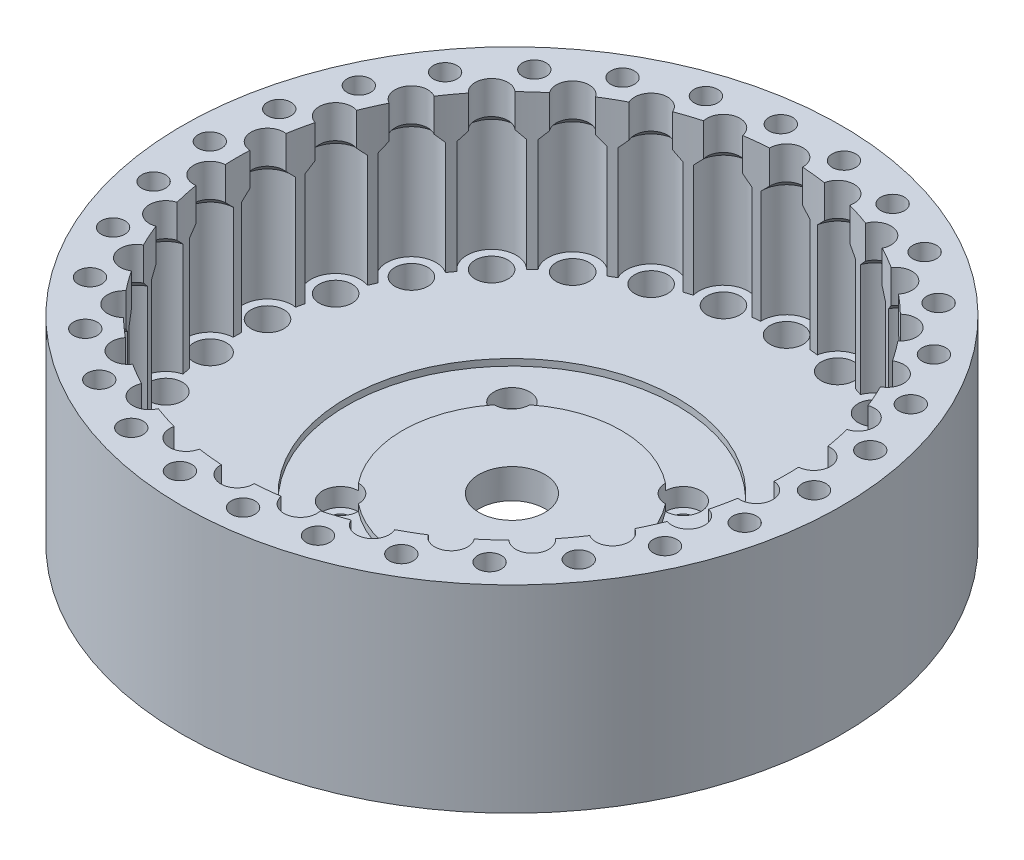
from build123d import *
from build123d.topology import SkipClean

# Parameters (mm, degrees)
SKETCH1_R                                           = 60
BOSS_EXTRUDE1_DEPTH                                 = 8
SKETCH2_R                                           = 3
CUT_EXTRUDE2_DEPTH                                  = 6
SKETCH3_R                                           = 60
BOSS_EXTRUDE2_DEPTH                                 = 28
BOSS_EXTRUDE3_START                                 = -6
BOSS_EXTRUDE3_DEPTH                                 = 6
CHAMFER1_SIZE                                       = 1.5
SKETCH5_R                                           = 6
CUT_EXTRUDE3_DEPTH                                  = 90.353231615
CBORE_FOR_M3_HEX_SOCKET_HEAD_CAP_SCREW1_D           = 3.6
CBORE_FOR_M3_HEX_SOCKET_HEAD_CAP_SCREW1_CBORE_D     = 6.5
CBORE_FOR_M3_HEX_SOCKET_HEAD_CAP_SCREW1_CBORE_DEPTH = 4.5
SKETCH10_R                                          = 11.25
CUT_EXTRUDE5_DEPTH                                  = 2.6
SKETCH11_R                                          = 30.1
SKETCH11_R_2                                        = 19.9
CUT_EXTRUDE6_DEPTH                                  = 1.2
F_4_3_4_3_DIAMETER_HOLE1_D                          = 4.3


with BuildPart() as part:
    # Sketch1 → Boss-Extrude1 (new body)
    with BuildSketch(Plane(origin=(0, 0, 0), x_dir=(1, 0, 0), z_dir=(0, 1, 0))):
        with Locations(Location((0, 0, 0), (0, 0, 270))):
            Circle(SKETCH1_R)
    extrude(amount=BOSS_EXTRUDE1_DEPTH)

    # Sketch2 → Cut-Extrude2 (cut)
    with BuildSketch(Plane(origin=(0, 8, 0), x_dir=(1, 0, 0), z_dir=(0, 1, 0))):
        with Locations(Location((0, 50, 0), (0, 0, 270))):
            Circle(SKETCH2_R)
        with Locations(Location((10.395584541, 48.907380037, 0), (0, 0, 270))):
            Circle(SKETCH2_R)
        with Locations(Location((20.336832154, 45.677272882, 0), (0, 0, 270))):
            Circle(SKETCH2_R)
        with Locations(Location((29.389262615, 40.450849719, 0), (0, 0, 270))):
            Circle(SKETCH2_R)
        with Locations(Location((37.157241274, 33.456530318, 0), (0, 0, 270))):
            Circle(SKETCH2_R)
        with Locations(Location((43.301270189, 25, 0), (0, 0, 270))):
            Circle(SKETCH2_R)
        with Locations(Location((47.552825815, 15.450849719, 0), (0, 0, 270))):
            Circle(SKETCH2_R)
        with Locations(Location((49.726094768, 5.226423163, 0), (0, 0, 270))):
            Circle(SKETCH2_R)
        with Locations(Location((49.726094768, -5.226423163, 0), (0, 0, 270))):
            Circle(SKETCH2_R)
        with Locations(Location((47.552825815, -15.450849719, 0), (0, 0, 270))):
            Circle(SKETCH2_R)
        with Locations(Location((43.301270189, -25, 0), (0, 0, 270))):
            Circle(SKETCH2_R)
        with Locations(Location((37.157241274, -33.456530318, 0), (0, 0, 270))):
            Circle(SKETCH2_R)
        with Locations(Location((29.389262615, -40.450849719, 0), (0, 0, 270))):
            Circle(SKETCH2_R)
        with Locations(Location((20.336832154, -45.677272882, 0), (0, 0, 270))):
            Circle(SKETCH2_R)
        with Locations(Location((10.395584541, -48.907380037, 0), (0, 0, 270))):
            Circle(SKETCH2_R)
        with Locations(Location((0, -50, 0), (0, 0, 270))):
            Circle(SKETCH2_R)
        with Locations(Location((-10.395584541, -48.907380037, 0), (0, 0, 270))):
            Circle(SKETCH2_R)
        with Locations(Location((-20.336832154, -45.677272882, 0), (0, 0, 270))):
            Circle(SKETCH2_R)
        with Locations(Location((-29.389262615, -40.450849719, 0), (0, 0, 270))):
            Circle(SKETCH2_R)
        with Locations(Location((-37.157241274, -33.456530318, 0), (0, 0, 270))):
            Circle(SKETCH2_R)
        with Locations(Location((-43.301270189, -25, 0), (0, 0, 270))):
            Circle(SKETCH2_R)
        with Locations(Location((-47.552825815, -15.450849719, 0), (0, 0, 270))):
            Circle(SKETCH2_R)
        with Locations(Location((-49.726094768, -5.226423163, 0), (0, 0, 270))):
            Circle(SKETCH2_R)
        with Locations(Location((-49.726094768, 5.226423163, 0), (0, 0, 270))):
            Circle(SKETCH2_R)
        with Locations(Location((-47.552825815, 15.450849719, 0), (0, 0, 270))):
            Circle(SKETCH2_R)
        with Locations(Location((-43.301270189, 25, 0), (0, 0, 270))):
            Circle(SKETCH2_R)
        with Locations(Location((-37.157241274, 33.456530318, 0), (0, 0, 270))):
            Circle(SKETCH2_R)
        with Locations(Location((-29.389262615, 40.450849719, 0), (0, 0, 270))):
            Circle(SKETCH2_R)
        with Locations(Location((-20.336832154, 45.677272882, 0), (0, 0, 270))):
            Circle(SKETCH2_R)
        with Locations(Location((-10.395584541, 48.907380037, 0), (0, 0, 270))):
            Circle(SKETCH2_R)
    extrude(amount=-CUT_EXTRUDE2_DEPTH, mode=Mode.SUBTRACT)

    # Sketch3 → Boss-Extrude2 (add)
    with BuildSketch(Plane(origin=(0, 8, 0), x_dir=(1, 0, 0), z_dir=(0, 1, 0))):
        with Locations(Location((0, 0, 0), (0, 0, 270))):
            Circle(SKETCH3_R)
        with BuildLine():
            ThreePointArc((-5.956277164, 49.643959979), (-5.226423163, 49.726094768), (-4.495441441, 49.7975))
            ThreePointArc((-4.495441441, 49.7975), (-0.101275652, 54.498860216), (4.5, 50))
            ThreePointArc((4.5, 50), (4.498860216, 49.898724348), (4.495441441, 49.7975))
            ThreePointArc((4.495441441, 49.7975), (5.226423163, 49.726094768), (5.956277164, 49.643959979))
            ThreePointArc((5.956277164, 49.643959979), (10.765122633, 53.392181214), (14.895584541, 48.907380037))
            ThreePointArc((14.895584541, 48.907380037), (14.859213342, 48.336400239), (14.750687683, 47.774650317))
            ThreePointArc((14.750687683, 47.774650317), (15.450849719, 47.552825815), (16.147677875, 47.320740688))
            ThreePointArc((16.147677875, 47.320740688), (21.173135252, 50.0988786), (24.836832154, 45.677272882))
            ThreePointArc((24.836832154, 45.677272882), (24.716325088, 44.642844712), (24.361258092, 43.663819166))
            ThreePointArc((24.361258092, 43.663819166), (25, 43.301270189), (25.633347578, 42.929377959))
            ThreePointArc((25.633347578, 42.929377959), (30.683168008, 44.76081594), (33.889262615, 40.450849719))
            ThreePointArc((33.889262615, 40.450849719), (33.636637041, 38.964306588), (32.907124624, 37.644669596))
            ThreePointArc((32.907124624, 37.644669596), (33.456530318, 37.157241274), (33.998716989, 36.661795415))
            ThreePointArc((33.998716989, 36.661795415), (38.894572664, 37.607636151), (41.657241274, 33.456530318))
            ThreePointArc((41.657241274, 33.456530318), (41.22596207, 31.534159105), (40.014791904, 29.980267325))
            ThreePointArc((40.014791904, 29.980267325), (40.450849719, 29.389262615), (40.878179324, 28.791916489))
            ThreePointArc((40.878179324, 28.791916489), (45.46299301, 28.946765061), (47.801270189, 25))
            ThreePointArc((47.801270189, 25), (47.146759598, 22.662862605), (45.373620765, 21.005583511))
            ThreePointArc((45.373620765, 21.005583511), (45.677272882, 20.336832154), (45.971069068, 19.663692654))
            ThreePointArc((45.971069068, 19.663692654), (50.115255779, 19.150032423), (52.052825815, 15.450849719))
            ThreePointArc((52.052825815, 15.450849719), (51.13295185, 12.724552308), (48.749404673, 11.112854901))
            ThreePointArc((48.749404673, 11.112854901), (48.907380037, 10.395584541), (49.054802499, 9.676071092))
            ThreePointArc((49.054802499, 9.676071092), (52.661157356, 8.637494492), (54.226094768, 5.226423163))
            ThreePointArc((54.226094768, 5.226423163), (53.00163282, 2.140835623), (49.99460567, 0.734441207))
            ThreePointArc((49.99460567, 0.734441207), (49.998651399, 0.367230508), (50, 0))
            ThreePointArc((50, 0), (49.998651399, -0.367230508), (49.99460567, -0.734441207))
            ThreePointArc((49.99460567, -0.734441207), (53.00163282, -2.140835623), (54.226094768, -5.226423163))
            ThreePointArc((54.226094768, -5.226423163), (52.661157356, -8.637494492), (49.054802499, -9.676071092))
            ThreePointArc((49.054802499, -9.676071092), (48.907380037, -10.395584541), (48.749404673, -11.112854901))
            ThreePointArc((48.749404673, -11.112854901), (51.13295185, -12.724552308), (52.052825815, -15.450849719))
            ThreePointArc((52.052825815, -15.450849719), (50.115255779, -19.150032423), (45.971069068, -19.663692654))
            ThreePointArc((45.971069068, -19.663692654), (45.677272882, -20.336832154), (45.373620765, -21.005583511))
            ThreePointArc((45.373620765, -21.005583511), (47.146759598, -22.662862605), (47.801270189, -25))
            ThreePointArc((47.801270189, -25), (45.46299301, -28.946765061), (40.878179324, -28.791916489))
            ThreePointArc((40.878179324, -28.791916489), (40.450849719, -29.389262615), (40.014791904, -29.980267325))
            ThreePointArc((40.014791904, -29.980267325), (41.22596207, -31.534159105), (41.657241274, -33.456530318))
            ThreePointArc((41.657241274, -33.456530318), (38.894572664, -37.607636151), (33.998716989, -36.661795415))
            ThreePointArc((33.998716989, -36.661795415), (33.456530318, -37.157241274), (32.907124624, -37.644669596))
            ThreePointArc((32.907124624, -37.644669596), (33.636637041, -38.964306588), (33.889262615, -40.450849719))
            ThreePointArc((33.889262615, -40.450849719), (30.683168008, -44.76081594), (25.633347578, -42.929377959))
            ThreePointArc((25.633347578, -42.929377959), (25, -43.301270189), (24.361258092, -43.663819166))
            ThreePointArc((24.361258092, -43.663819166), (24.716325088, -44.642844712), (24.836832154, -45.677272882))
            ThreePointArc((24.836832154, -45.677272882), (21.173135252, -50.0988786), (16.147677875, -47.320740688))
            ThreePointArc((16.147677875, -47.320740688), (15.450849719, -47.552825815), (14.750687683, -47.774650317))
            ThreePointArc((14.750687683, -47.774650317), (14.859213342, -48.336400239), (14.895584541, -48.907380037))
            ThreePointArc((14.895584541, -48.907380037), (10.765122633, -53.392181214), (5.956277164, -49.643959979))
            ThreePointArc((5.956277164, -49.643959979), (5.226423163, -49.726094768), (4.495441441, -49.7975))
            ThreePointArc((4.495441441, -49.7975), (4.498860216, -49.898724348), (4.5, -50))
            ThreePointArc((4.5, -50), (-0.101275652, -54.498860216), (-4.495441441, -49.7975))
            ThreePointArc((-4.495441441, -49.7975), (-5.226423163, -49.726094768), (-5.956277164, -49.643959979))
            ThreePointArc((-5.956277164, -49.643959979), (-11.33118715, -53.30904424), (-14.750687683, -47.774650317))
            ThreePointArc((-14.750687683, -47.774650317), (-15.450849719, -47.552825815), (-16.147677875, -47.320740688))
            ThreePointArc((-16.147677875, -47.320740688), (-22.167147048, -49.788227442), (-24.361258092, -43.663819166))
            ThreePointArc((-24.361258092, -43.663819166), (-25, -43.301270189), (-25.633347578, -42.929377959))
            ThreePointArc((-25.633347578, -42.929377959), (-32.03429625, -44.091426193), (-32.907124624, -37.644669596))
            ThreePointArc((-32.907124624, -37.644669596), (-33.456530318, -37.157241274), (-33.998716989, -36.661795415))
            ThreePointArc((-33.998716989, -36.661795415), (-40.501392989, -36.467618047), (-40.014791904, -29.980267325))
            ThreePointArc((-40.014791904, -29.980267325), (-40.450849719, -29.389262615), (-40.878179324, -28.791916489))
            ThreePointArc((-40.878179324, -28.791916489), (-47.198384506, -27.25), (-45.373620765, -21.005583511))
            ThreePointArc((-45.373620765, -21.005583511), (-45.677272882, -20.336832154), (-45.971069068, -19.663692654))
            ThreePointArc((-45.971069068, -19.663692654), (-51.832580138, -16.841426193), (-48.749404673, -11.112854901))
            ThreePointArc((-48.749404673, -11.112854901), (-48.907380037, -10.395584541), (-49.054802499, -9.676071092))
            ThreePointArc((-49.054802499, -9.676071092), (-54.201443298, -5.696801248), (-49.99460567, -0.734441207))
            ThreePointArc((-49.99460567, -0.734441207), (-50, 0), (-49.99460567, 0.734441207))
            ThreePointArc((-49.99460567, 0.734441207), (-54.201443298, 5.696801248), (-49.054802499, 9.676071092))
            ThreePointArc((-49.054802499, 9.676071092), (-48.907380037, 10.395584541), (-48.749404673, 11.112854901))
            ThreePointArc((-48.749404673, 11.112854901), (-51.832580138, 16.841426193), (-45.971069068, 19.663692654))
            ThreePointArc((-45.971069068, 19.663692654), (-45.677272882, 20.336832154), (-45.373620765, 21.005583511))
            ThreePointArc((-45.373620765, 21.005583511), (-47.198384506, 27.25), (-40.878179324, 28.791916489))
            ThreePointArc((-40.878179324, 28.791916489), (-40.450849719, 29.389262615), (-40.014791904, 29.980267325))
            ThreePointArc((-40.014791904, 29.980267325), (-40.501392989, 36.467618047), (-33.998716989, 36.661795415))
            ThreePointArc((-33.998716989, 36.661795415), (-33.456530318, 37.157241274), (-32.907124624, 37.644669596))
            ThreePointArc((-32.907124624, 37.644669596), (-32.03429625, 44.091426193), (-25.633347578, 42.929377959))
            ThreePointArc((-25.633347578, 42.929377959), (-25, 43.301270189), (-24.361258092, 43.663819166))
            ThreePointArc((-24.361258092, 43.663819166), (-22.167147048, 49.788227442), (-16.147677875, 47.320740688))
            ThreePointArc((-16.147677875, 47.320740688), (-15.450849719, 47.552825815), (-14.750687683, 47.774650317))
            ThreePointArc((-14.750687683, 47.774650317), (-11.33118715, 53.30904424), (-5.956277164, 49.643959979))
        make_face(mode=Mode.SUBTRACT)
    extrude(amount=BOSS_EXTRUDE2_DEPTH)

    # Sketch4 → Boss-Extrude3 (add)
    with SkipClean():  # the faces are left unmerged after this step: merging them gives an invalid solid
        with BuildSketch(Plane(origin=(0, 36, 0), x_dir=(1, 0, 0), z_dir=(0, 1, 0)).offset(BOSS_EXTRUDE3_START)):
            with BuildLine():
                ThreePointArc((2.998649696, 49.91), (0, 53), (-2.998649696, 49.91))
                ThreePointArc((-2.998649696, 49.91), (-3.747467752, 49.859367078), (-4.495441441, 49.7975))
                ThreePointArc((-4.495441441, 49.7975), (0, 54.5), (4.495441441, 49.7975))
                ThreePointArc((4.495441441, 49.7975), (3.747467752, 49.859367078), (2.998649696, 49.91))
            make_face()
            with BuildLine():
                ThreePointArc((13.309994494, 48.195892424), (11.019319613, 51.841822839), (7.443750483, 49.442801081))
                ThreePointArc((7.443750483, 49.442801081), (6.700768721, 49.548962638), (5.956277164, 49.643959979))
                ThreePointArc((5.956277164, 49.643959979), (11.33118715, 53.30904424), (14.750687683, 47.774650317))
                ThreePointArc((14.750687683, 47.774650317), (14.031921903, 47.990677925), (13.309994494, 48.195892424))
            make_face()
            with BuildLine():
                ThreePointArc((23.039628665, 44.37539308), (21.557042083, 48.417909255), (17.560823047, 46.814714502))
                ThreePointArc((17.560823047, 46.814714502), (16.856149448, 47.073030769), (16.147677875, 47.320740688))
                ThreePointArc((16.147677875, 47.320740688), (22.167147048, 49.788227442), (24.361258092, 43.663819166))
                ThreePointArc((24.361258092, 43.663819166), (23.703113734, 44.024565862), (23.039628665, 44.37539308))
            make_face()
            with BuildLine():
                ThreePointArc((31.762320506, 38.615476121), (31.152618372, 42.877900702), (26.910403378, 42.140600257))
                ThreePointArc((26.910403378, 42.140600257), (26.27483556, 42.539781573), (25.633347578, 42.929377959))
                ThreePointArc((25.633347578, 42.929377959), (32.03429625, 44.091426193), (32.907124624, 37.644669596))
                ThreePointArc((32.907124624, 37.644669596), (32.338365755, 38.134369017), (31.762320506, 38.615476121))
            make_face()
            with BuildLine():
                ThreePointArc((39.096846529, 31.167877558), (39.38667575, 35.463922137), (35.08386995, 35.624739568))
                ThreePointArc((35.08386995, 35.624739568), (34.545185276, 36.147339795), (33.998716989, 36.661795415))
                ThreePointArc((33.998716989, 36.661795415), (40.501392989, 36.467618047), (40.014791904, 29.980267325))
                ThreePointArc((40.014791904, 29.980267325), (39.560276015, 30.577517257), (39.096846529, 31.167877558))
            make_face()
            with BuildLine():
                ThreePointArc((44.722652751, 22.358093186), (45.899346401, 26.5), (41.724003055, 27.551906814))
                ThreePointArc((41.724003055, 27.551906814), (41.30574463, 28.175085813), (40.878179324, 28.791916489))
                ThreePointArc((40.878179324, 28.791916489), (47.198384506, 27.25), (45.373620765, 21.005583511))
                ThreePointArc((45.373620765, 21.005583511), (45.053212383, 21.684281266), (44.722652751, 22.358093186))
            make_face()
            with BuildLine():
                ThreePointArc((48.393864445, 12.571152856), (50.405995364, 16.377900702), (46.540597012, 18.274923523))
                ThreePointArc((46.540597012, 18.274923523), (46.261044737, 18.971445382), (45.971069068, 19.663692654))
                ThreePointArc((45.971069068, 19.663692654), (51.832580138, 16.841426193), (48.749404673, 11.112854901))
                ThreePointArc((48.749404673, 11.112854901), (48.57710718, 11.84333813), (48.393864445, 12.571152856))
            make_face()
            with BuildLine():
                ThreePointArc((49.950032042, 2.234792822), (52.709660455, 5.540008553), (49.323143553, 8.199238381))
                ThreePointArc((49.323143553, 8.199238381), (49.194515203, 8.938661752), (49.054802499, 9.676071092))
                ThreePointArc((49.054802499, 9.676071092), (54.201443298, 5.696801248), (49.99460567, 0.734441207))
                ThreePointArc((49.99460567, 0.734441207), (49.977949294, 1.484784288), (49.950032042, 2.234792822))
            make_face()
            with BuildLine():
                ThreePointArc((49.323143553, -8.199238381), (52.709660455, -5.540008553), (49.950032042, -2.234792822))
                ThreePointArc((49.950032042, -2.234792822), (49.977949294, -1.484784288), (49.99460567, -0.734441207))
                ThreePointArc((49.99460567, -0.734441207), (54.201443298, -5.696801248), (49.054802499, -9.676071092))
                ThreePointArc((49.054802499, -9.676071092), (49.194515203, -8.938661752), (49.323143553, -8.199238381))
            make_face()
            with BuildLine():
                ThreePointArc((46.540597012, -18.274923523), (50.405995364, -16.377900702), (48.393864445, -12.571152856))
                ThreePointArc((48.393864445, -12.571152856), (48.57710718, -11.84333813), (48.749404673, -11.112854901))
                ThreePointArc((48.749404673, -11.112854901), (51.832580138, -16.841426193), (45.971069068, -19.663692654))
                ThreePointArc((45.971069068, -19.663692654), (46.261044737, -18.971445382), (46.540597012, -18.274923523))
            make_face()
            with BuildLine():
                ThreePointArc((41.724003055, -27.551906814), (45.899346401, -26.5), (44.722652751, -22.358093186))
                ThreePointArc((44.722652751, -22.358093186), (45.053212383, -21.684281266), (45.373620765, -21.005583511))
                ThreePointArc((45.373620765, -21.005583511), (47.198384506, -27.25), (40.878179324, -28.791916489))
                ThreePointArc((40.878179324, -28.791916489), (41.30574463, -28.175085813), (41.724003055, -27.551906814))
            make_face()
            with BuildLine():
                ThreePointArc((35.08386995, -35.624739568), (39.38667575, -35.463922137), (39.096846529, -31.167877558))
                ThreePointArc((39.096846529, -31.167877558), (39.560276015, -30.577517257), (40.014791904, -29.980267325))
                ThreePointArc((40.014791904, -29.980267325), (40.501392989, -36.467618047), (33.998716989, -36.661795415))
                ThreePointArc((33.998716989, -36.661795415), (34.545185276, -36.147339795), (35.08386995, -35.624739568))
            make_face()
            with BuildLine():
                ThreePointArc((26.910403378, -42.140600257), (31.152618372, -42.877900702), (31.762320506, -38.615476121))
                ThreePointArc((31.762320506, -38.615476121), (32.338365755, -38.134369017), (32.907124624, -37.644669596))
                ThreePointArc((32.907124624, -37.644669596), (32.03429625, -44.091426193), (25.633347578, -42.929377959))
                ThreePointArc((25.633347578, -42.929377959), (26.27483556, -42.539781573), (26.910403378, -42.140600257))
            make_face()
            with BuildLine():
                ThreePointArc((17.560823047, -46.814714502), (21.557042083, -48.417909255), (23.039628665, -44.37539308))
                ThreePointArc((23.039628665, -44.37539308), (23.703113734, -44.024565862), (24.361258092, -43.663819166))
                ThreePointArc((24.361258092, -43.663819166), (22.167147048, -49.788227442), (16.147677875, -47.320740688))
                ThreePointArc((16.147677875, -47.320740688), (16.856149448, -47.073030769), (17.560823047, -46.814714502))
            make_face()
            with BuildLine():
                ThreePointArc((7.443750483, -49.442801081), (11.019319613, -51.841822839), (13.309994494, -48.195892424))
                ThreePointArc((13.309994494, -48.195892424), (14.031921903, -47.990677925), (14.750687683, -47.774650317))
                ThreePointArc((14.750687683, -47.774650317), (11.33118715, -53.30904424), (5.956277164, -49.643959979))
                ThreePointArc((5.956277164, -49.643959979), (6.700768721, -49.548962638), (7.443750483, -49.442801081))
            make_face()
            with BuildLine():
                ThreePointArc((-2.998649696, -49.91), (0, -53), (2.998649696, -49.91))
                ThreePointArc((2.998649696, -49.91), (3.747467752, -49.859367078), (4.495441441, -49.7975))
                ThreePointArc((4.495441441, -49.7975), (0, -54.5), (-4.495441441, -49.7975))
                ThreePointArc((-4.495441441, -49.7975), (-3.747467752, -49.859367078), (-2.998649696, -49.91))
            make_face()
            with BuildLine():
                ThreePointArc((-13.309994494, -48.195892424), (-11.019319613, -51.841822839), (-7.443750483, -49.442801081))
                ThreePointArc((-7.443750483, -49.442801081), (-6.700768721, -49.548962638), (-5.956277164, -49.643959979))
                ThreePointArc((-5.956277164, -49.643959979), (-11.33118715, -53.30904424), (-14.750687683, -47.774650317))
                ThreePointArc((-14.750687683, -47.774650317), (-14.031921903, -47.990677925), (-13.309994494, -48.195892424))
            make_face()
            with BuildLine():
                ThreePointArc((-23.039628665, -44.37539308), (-21.557042083, -48.417909255), (-17.560823047, -46.814714502))
                ThreePointArc((-17.560823047, -46.814714502), (-16.856149448, -47.073030769), (-16.147677875, -47.320740688))
                ThreePointArc((-16.147677875, -47.320740688), (-22.167147048, -49.788227442), (-24.361258092, -43.663819166))
                ThreePointArc((-24.361258092, -43.663819166), (-23.703113734, -44.024565862), (-23.039628665, -44.37539308))
            make_face()
            with BuildLine():
                ThreePointArc((-31.762320506, -38.615476121), (-31.152618372, -42.877900702), (-26.910403378, -42.140600257))
                ThreePointArc((-26.910403378, -42.140600257), (-26.27483556, -42.539781573), (-25.633347578, -42.929377959))
                ThreePointArc((-25.633347578, -42.929377959), (-32.03429625, -44.091426193), (-32.907124624, -37.644669596))
                ThreePointArc((-32.907124624, -37.644669596), (-32.338365755, -38.134369017), (-31.762320506, -38.615476121))
            make_face()
            with BuildLine():
                ThreePointArc((-39.096846529, -31.167877558), (-39.38667575, -35.463922137), (-35.08386995, -35.624739568))
                ThreePointArc((-35.08386995, -35.624739568), (-34.545185276, -36.147339795), (-33.998716989, -36.661795415))
                ThreePointArc((-33.998716989, -36.661795415), (-40.501392989, -36.467618047), (-40.014791904, -29.980267325))
                ThreePointArc((-40.014791904, -29.980267325), (-39.560276015, -30.577517257), (-39.096846529, -31.167877558))
            make_face()
            with BuildLine():
                ThreePointArc((-44.722652751, -22.358093186), (-45.899346401, -26.5), (-41.724003055, -27.551906814))
                ThreePointArc((-41.724003055, -27.551906814), (-41.30574463, -28.175085813), (-40.878179324, -28.791916489))
                ThreePointArc((-40.878179324, -28.791916489), (-47.198384506, -27.25), (-45.373620765, -21.005583511))
                ThreePointArc((-45.373620765, -21.005583511), (-45.053212383, -21.684281266), (-44.722652751, -22.358093186))
            make_face()
            with BuildLine():
                ThreePointArc((-48.393864445, -12.571152856), (-50.405995364, -16.377900702), (-46.540597012, -18.274923523))
                ThreePointArc((-46.540597012, -18.274923523), (-46.261044737, -18.971445382), (-45.971069068, -19.663692654))
                ThreePointArc((-45.971069068, -19.663692654), (-51.832580138, -16.841426193), (-48.749404673, -11.112854901))
                ThreePointArc((-48.749404673, -11.112854901), (-48.57710718, -11.84333813), (-48.393864445, -12.571152856))
            make_face()
            with BuildLine():
                ThreePointArc((-49.950032042, -2.234792822), (-52.709660455, -5.540008553), (-49.323143553, -8.199238381))
                ThreePointArc((-49.323143553, -8.199238381), (-49.194515203, -8.938661752), (-49.054802499, -9.676071092))
                ThreePointArc((-49.054802499, -9.676071092), (-54.201443298, -5.696801248), (-49.99460567, -0.734441207))
                ThreePointArc((-49.99460567, -0.734441207), (-49.977949294, -1.484784288), (-49.950032042, -2.234792822))
            make_face()
            with BuildLine():
                ThreePointArc((-49.323143553, 8.199238381), (-52.709660455, 5.540008553), (-49.950032042, 2.234792822))
                ThreePointArc((-49.950032042, 2.234792822), (-49.977949294, 1.484784288), (-49.99460567, 0.734441207))
                ThreePointArc((-49.99460567, 0.734441207), (-54.201443298, 5.696801248), (-49.054802499, 9.676071092))
                ThreePointArc((-49.054802499, 9.676071092), (-49.194515203, 8.938661752), (-49.323143553, 8.199238381))
            make_face()
            with BuildLine():
                ThreePointArc((-46.540597012, 18.274923523), (-50.405995364, 16.377900702), (-48.393864445, 12.571152856))
                ThreePointArc((-48.393864445, 12.571152856), (-48.57710718, 11.84333813), (-48.749404673, 11.112854901))
                ThreePointArc((-48.749404673, 11.112854901), (-51.832580138, 16.841426193), (-45.971069068, 19.663692654))
                ThreePointArc((-45.971069068, 19.663692654), (-46.261044737, 18.971445382), (-46.540597012, 18.274923523))
            make_face()
            with BuildLine():
                ThreePointArc((-41.724003055, 27.551906814), (-45.899346401, 26.5), (-44.722652751, 22.358093186))
                ThreePointArc((-44.722652751, 22.358093186), (-45.053212383, 21.684281266), (-45.373620765, 21.005583511))
                ThreePointArc((-45.373620765, 21.005583511), (-47.198384506, 27.25), (-40.878179324, 28.791916489))
                ThreePointArc((-40.878179324, 28.791916489), (-41.30574463, 28.175085813), (-41.724003055, 27.551906814))
            make_face()
            with BuildLine():
                ThreePointArc((-35.08386995, 35.624739568), (-39.38667575, 35.463922137), (-39.096846529, 31.167877558))
                ThreePointArc((-39.096846529, 31.167877558), (-39.560276015, 30.577517257), (-40.014791904, 29.980267325))
                ThreePointArc((-40.014791904, 29.980267325), (-40.501392989, 36.467618047), (-33.998716989, 36.661795415))
                ThreePointArc((-33.998716989, 36.661795415), (-34.545185276, 36.147339795), (-35.08386995, 35.624739568))
            make_face()
            with BuildLine():
                ThreePointArc((-26.910403378, 42.140600257), (-31.152618372, 42.877900702), (-31.762320506, 38.615476121))
                ThreePointArc((-31.762320506, 38.615476121), (-32.338365755, 38.134369017), (-32.907124624, 37.644669596))
                ThreePointArc((-32.907124624, 37.644669596), (-32.03429625, 44.091426193), (-25.633347578, 42.929377959))
                ThreePointArc((-25.633347578, 42.929377959), (-26.27483556, 42.539781573), (-26.910403378, 42.140600257))
            make_face()
            with BuildLine():
                ThreePointArc((-17.560823047, 46.814714502), (-21.557042083, 48.417909255), (-23.039628665, 44.37539308))
                ThreePointArc((-23.039628665, 44.37539308), (-23.703113734, 44.024565862), (-24.361258092, 43.663819166))
                ThreePointArc((-24.361258092, 43.663819166), (-22.167147048, 49.788227442), (-16.147677875, 47.320740688))
                ThreePointArc((-16.147677875, 47.320740688), (-16.856149448, 47.073030769), (-17.560823047, 46.814714502))
            make_face()
            with BuildLine():
                ThreePointArc((-7.443750483, 49.442801081), (-11.019319613, 51.841822839), (-13.309994494, 48.195892424))
                ThreePointArc((-13.309994494, 48.195892424), (-14.031921903, 47.990677925), (-14.750687683, 47.774650317))
                ThreePointArc((-14.750687683, 47.774650317), (-11.33118715, 53.30904424), (-5.956277164, 49.643959979))
                ThreePointArc((-5.956277164, 49.643959979), (-6.700768721, 49.548962638), (-7.443750483, 49.442801081))
            make_face()
        extrude(amount=BOSS_EXTRUDE3_DEPTH)

    # Chamfer1
    # the kernel refuses this chamfer: 1.5 mm, written as the material it adds along each edge
    with BuildSketch(Plane(origin=(0, 30, -50), x_dir=(-0.6187378259275311, 0, 0.7855975450359248), z_dir=(0.7855975450359248, 0, 0.6187378259275311))) as chamfer1_piece_1_section:
        Polygon((4.5, CHAMFER1_SIZE), (4.5 - CHAMFER1_SIZE, 0), (4.5, 0), align=None)
    chamfer1_piece_1 = revolve(axis=Axis((0, 30, -50), (0, -1, 0)), revolution_arc=231.775977692, mode=Mode.PRIVATE)
    chamfer1_piece_1 = chamfer1_piece_1 - Plane(origin=(0, 30, 0), x_dir=(-0.11912554327367263, 0, -0.9928791995704979), z_dir=(0, -1, 0)) * Cylinder(50, 18, mode=Mode.PRIVATE)
    add(chamfer1_piece_1)
    with BuildSketch(Plane(origin=(43.301270189, 30, -25), x_dir=(-0.9897221230498684, 0, -0.14300391304317928), z_dir=(-0.14300391304317928, 0, 0.9897221230498684))) as chamfer1_piece_2_section:
        Polygon((4.5, CHAMFER1_SIZE), (4.5 - CHAMFER1_SIZE, 0), (4.5, 0), align=None)
    chamfer1_piece_2 = revolve(axis=Axis((43.301270189, 30, -25), (0, -1, 0)), revolution_arc=283.556585499, mode=Mode.PRIVATE)
    chamfer1_piece_2 = chamfer1_piece_2 - Plane(origin=(0, 30, 0), x_dir=(0.8002958380803438, 0, -0.5996053464999126), z_dir=(0, -1, 0)) * Cylinder(50, 19, mode=Mode.PRIVATE)
    add(chamfer1_piece_2)
    with BuildSketch(Plane(origin=(37.157241274, 30, -33.456530318), x_dir=(-0.9978265054087605, 0, 0.06589586560430719), z_dir=(0.06589586560430719, 0, 0.9978265054087605))) as chamfer1_piece_3_section:
        Polygon((4.5, CHAMFER1_SIZE), (4.5 - CHAMFER1_SIZE, 0), (4.5, 0), align=None)
    chamfer1_piece_3 = revolve(axis=Axis((37.157241274, 30, -33.456530318), (0, -1, 0)), revolution_arc=283.556585499, mode=Mode.PRIVATE)
    chamfer1_piece_3 = chamfer1_piece_3 - Plane(origin=(0, 30, 0), x_dir=(0.6581424924813841, 0, -0.7528933919157421), z_dir=(0, -1, 0)) * Cylinder(50, 19, mode=Mode.PRIVATE)
    add(chamfer1_piece_3)
    with BuildSketch(Plane(origin=(29.389262615, 30, -40.450849719), x_dir=(-0.9623210813784865, 0, 0.2719156787214381), z_dir=(0.2719156787214381, 0, 0.9623210813784865))) as chamfer1_piece_4_section:
        Polygon((4.5, CHAMFER1_SIZE), (4.5 - CHAMFER1_SIZE, 0), (4.5, 0), align=None)
    chamfer1_piece_4 = revolve(axis=Axis((29.389262615, 30, -40.450849719), (0, -1, 0)), revolution_arc=283.556585499, mode=Mode.PRIVATE)
    chamfer1_piece_4 = chamfer1_piece_4 - Plane(origin=(0, 30, 0), x_dir=(0.4872251618429115, 0, -0.8732763833215398), z_dir=(0, -1, 0)) * Cylinder(50, 19, mode=Mode.PRIVATE)
    add(chamfer1_piece_4)
    with BuildSketch(Plane(origin=(20.336832154, 30, -45.677272882), x_dir=(-0.8847576083630998, 0, 0.46605147188224566), z_dir=(0.46605147188224566, 0, 0.8847576083630998))) as chamfer1_piece_5_section:
        Polygon((4.5, CHAMFER1_SIZE), (4.5 - CHAMFER1_SIZE, 0), (4.5, 0), align=None)
    chamfer1_piece_5 = revolve(axis=Axis((20.336832154, 30, -45.677272882), (0, -1, 0)), revolution_arc=283.556585499, mode=Mode.PRIVATE)
    chamfer1_piece_5 = chamfer1_piece_5 - Plane(origin=(0, 30, 0), x_dir=(0.29501375366623145, 0, -0.9554930063311611), z_dir=(0, -1, 0)) * Cylinder(50, 19, mode=Mode.PRIVATE)
    add(chamfer1_piece_5)
    with BuildSketch(Plane(origin=(10.395584541, 30, -48.907380037), x_dir=(-0.7685259823242004, 0, 0.6398185793587295), z_dir=(0.6398185793587295, 0, 0.7685259823242004))) as chamfer1_piece_6_section:
        Polygon((4.5, CHAMFER1_SIZE), (4.5 - CHAMFER1_SIZE, 0), (4.5, 0), align=None)
    chamfer1_piece_6 = revolve(axis=Axis((10.395584541, 30, -48.907380037), (0, -1, 0)), revolution_arc=283.556585499, mode=Mode.PRIVATE)
    chamfer1_piece_6 = chamfer1_piece_6 - Plane(origin=(0, 30, 0), x_dir=(0.08990882882121899, 0, -0.9959499999999983), z_dir=(0, -1, 0)) * Cylinder(50, 19, mode=Mode.PRIVATE)
    add(chamfer1_piece_6)
    with BuildSketch(Plane(origin=(-10.395584541, 30, -48.907380037), x_dir=(-0.44184575908670554, 0, 0.8970910350555805), z_dir=(0.8970910350555805, 0, 0.44184575908670554))) as chamfer1_piece_7_section:
        Polygon((4.5, CHAMFER1_SIZE), (4.5 - CHAMFER1_SIZE, 0), (4.5, 0), align=None)
    chamfer1_piece_7 = revolve(axis=Axis((-10.395584541, 30, -48.907380037), (0, -1, 0)), revolution_arc=283.556585499, mode=Mode.PRIVATE)
    chamfer1_piece_7 = chamfer1_piece_7 - Plane(origin=(0, 30, 0), x_dir=(-0.32295355749975374, 0, -0.9464148137567656), z_dir=(0, -1, 0)) * Cylinder(50, 19, mode=Mode.PRIVATE)
    add(chamfer1_piece_7)
    with BuildSketch(Plane(origin=(-20.336832154, 30, -45.677272882), x_dir=(-0.24567465522922202, 0, 0.9693523424317925), z_dir=(0.9693523424317925, 0, 0.24567465522922202))) as chamfer1_piece_8_section:
        Polygon((4.5, CHAMFER1_SIZE), (4.5 - CHAMFER1_SIZE, 0), (4.5, 0), align=None)
    chamfer1_piece_8 = revolve(axis=Axis((-20.336832154, 30, -45.677272882), (0, -1, 0)), revolution_arc=283.556585499, mode=Mode.PRIVATE)
    chamfer1_piece_8 = chamfer1_piece_8 - Plane(origin=(0, 30, 0), x_dir=(-0.5126669515599944, 0, -0.858587559179716), z_dir=(0, -1, 0)) * Cylinder(50, 19, mode=Mode.PRIVATE)
    add(chamfer1_piece_8)
    with BuildSketch(Plane(origin=(-29.389262615, 30, -40.450849719), x_dir=(-0.038766390060423005, 0, 0.9992483009751295), z_dir=(0.9992483009751295, 0, 0.038766390060423005))) as chamfer1_piece_9_section:
        Polygon((4.5, CHAMFER1_SIZE), (4.5 - CHAMFER1_SIZE, 0), (4.5, 0), align=None)
    chamfer1_piece_9 = revolve(axis=Axis((-29.389262615, 30, -40.450849719), (0, -1, 0)), revolution_arc=283.556585499, mode=Mode.PRIVATE)
    chamfer1_piece_9 = chamfer1_piece_9 - Plane(origin=(0, 30, 0), x_dir=(-0.679974339788068, 0, -0.7332359083063112), z_dir=(0, -1, 0)) * Cylinder(50, 19, mode=Mode.PRIVATE)
    add(chamfer1_piece_9)
    with BuildSketch(Plane(origin=(-37.157241274, 30, -33.456530318), x_dir=(0.1698361523758002, 0, 0.9854723138405177), z_dir=(0.9854723138405177, 0, -0.1698361523758002))) as chamfer1_piece_10_section:
        Polygon((4.5, CHAMFER1_SIZE), (4.5 - CHAMFER1_SIZE, 0), (4.5, 0), align=None)
    chamfer1_piece_10 = revolve(axis=Axis((-37.157241274, 30, -33.456530318), (0, -1, 0)), revolution_arc=283.556585499, mode=Mode.PRIVATE)
    chamfer1_piece_10 = chamfer1_piece_10 - Plane(origin=(0, 30, 0), x_dir=(-0.8175635864885188, 0, -0.5758383297836557), z_dir=(0, -1, 0)) * Cylinder(50, 18, mode=Mode.PRIVATE)
    add(chamfer1_piece_10)
    with BuildSketch(Plane(origin=(-43.301270189, 30, -25), x_dir=(0.37101603998891614, 0, 0.9286264577702613), z_dir=(0.9286264577702613, 0, -0.37101603998891614))) as chamfer1_piece_11_section:
        Polygon((4.5, CHAMFER1_SIZE), (4.5 - CHAMFER1_SIZE, 0), (4.5, 0), align=None)
    chamfer1_piece_11 = revolve(axis=Axis((-43.301270189, 30, -25), (0, -1, 0)), revolution_arc=283.556585499, mode=Mode.PRIVATE)
    chamfer1_piece_11 = chamfer1_piece_11 - Plane(origin=(0, 30, 0), x_dir=(-0.9194213813540774, 0, -0.393273853070555), z_dir=(0, -1, 0)) * Cylinder(50, 19, mode=Mode.PRIVATE)
    add(chamfer1_piece_11)
    with BuildSketch(Plane(origin=(-47.552825815, 30, -15.450849719), x_dir=(0.555980746322039, 0, 0.831195169451308), z_dir=(0.831195169451308, 0, -0.555980746322039))) as chamfer1_piece_12_section:
        Polygon((4.5, CHAMFER1_SIZE), (4.5 - CHAMFER1_SIZE, 0), (4.5, 0), align=None)
    chamfer1_piece_12 = revolve(axis=Axis((-47.552825815, 30, -15.450849719), (0, -1, 0)), revolution_arc=283.556585499, mode=Mode.PRIVATE)
    chamfer1_piece_12 = chamfer1_piece_12 - Plane(origin=(0, 30, 0), x_dir=(-0.981096049981165, 0, -0.1935214218409826), z_dir=(0, -1, 0)) * Cylinder(50, 19, mode=Mode.PRIVATE)
    add(chamfer1_piece_12)
    with BuildSketch(Plane(origin=(-49.726094768, 30, -5.226423163), x_dir=(0.7166464261492662, 0, 0.6974366637103935), z_dir=(0.6974366637103935, 0, -0.7166464261492662))) as chamfer1_piece_13_section:
        Polygon((4.5, CHAMFER1_SIZE), (4.5 - CHAMFER1_SIZE, 0), (4.5, 0), align=None)
    chamfer1_piece_13 = revolve(axis=Axis((-49.726094768, 30, -5.226423163), (0, -1, 0)), revolution_arc=283.556585499, mode=Mode.PRIVATE)
    chamfer1_piece_13 = chamfer1_piece_13 - Plane(origin=(0, 30, 0), x_dir=(-0.9998921134029056, 0, 0.014688824141880873), z_dir=(0, -1, 0)) * Cylinder(50, 19, mode=Mode.PRIVATE)
    add(chamfer1_piece_13)
    with BuildSketch(Plane(origin=(-49.726094768, 30, 5.226423163), x_dir=(0.8459912183026883, 0, 0.5331968290929094), z_dir=(0.5331968290929094, 0, -0.8459912183026883))) as chamfer1_piece_14_section:
        Polygon((4.5, CHAMFER1_SIZE), (4.5 - CHAMFER1_SIZE, 0), (4.5, 0), align=None)
    chamfer1_piece_14 = revolve(axis=Axis((-49.726094768, 30, 5.226423163), (0, -1, 0)), revolution_arc=283.556585499, mode=Mode.PRIVATE)
    chamfer1_piece_14 = chamfer1_piece_14 - Plane(origin=(0, 30, 0), x_dir=(-0.9749880934542403, 0, 0.22225709802493498), z_dir=(0, -1, 0)) * Cylinder(50, 19, mode=Mode.PRIVATE)
    add(chamfer1_piece_14)
    with BuildSketch(Plane(origin=(-47.552825815, 30, 15.450849719), x_dir=(0.9383621347000182, 0, 0.3456537344818149), z_dir=(0.3456537344818149, 0, -0.9383621347000182))) as chamfer1_piece_15_section:
        Polygon((4.5, CHAMFER1_SIZE), (4.5 - CHAMFER1_SIZE, 0), (4.5, 0), align=None)
    chamfer1_piece_15 = revolve(axis=Axis((-47.552825815, 30, 15.450849719), (0, -1, 0)), revolution_arc=283.556585499, mode=Mode.PRIVATE)
    chamfer1_piece_15 = chamfer1_piece_15 - Plane(origin=(0, 30, 0), x_dir=(-0.9074724153096744, 0, 0.4201116702164152), z_dir=(0, -1, 0)) * Cylinder(50, 19, mode=Mode.PRIVATE)
    add(chamfer1_piece_15)
    with BuildSketch(Plane(origin=(-43.301270189, 30, 25), x_dir=(0.9897221230498621, 0, 0.14300391304322246), z_dir=(0.14300391304322246, 0, -0.9897221230498621))) as chamfer1_piece_16_section:
        Polygon((4.5, CHAMFER1_SIZE), (4.5 - CHAMFER1_SIZE, 0), (4.5, 0), align=None)
    chamfer1_piece_16 = revolve(axis=Axis((-43.301270189, 30, 25), (0, -1, 0)), revolution_arc=283.556585499, mode=Mode.PRIVATE)
    chamfer1_piece_16 = chamfer1_piece_16 - Plane(origin=(0, 30, 0), x_dir=(-0.8002958380803094, 0, 0.5996053464999584), z_dir=(0, -1, 0)) * Cylinder(50, 18, mode=Mode.PRIVATE)
    add(chamfer1_piece_16)
    with BuildSketch(Plane(origin=(-37.157241274, 30, 33.456530318), x_dir=(0.997826505408763, 0, -0.06589586560426924), z_dir=(-0.06589586560426924, 0, -0.997826505408763))) as chamfer1_piece_17_section:
        Polygon((4.5, CHAMFER1_SIZE), (4.5 - CHAMFER1_SIZE, 0), (4.5, 0), align=None)
    chamfer1_piece_17 = revolve(axis=Axis((-37.157241274, 30, 33.456530318), (0, -1, 0)), revolution_arc=283.556585499, mode=Mode.PRIVATE)
    chamfer1_piece_17 = chamfer1_piece_17 - Plane(origin=(0, 30, 0), x_dir=(-0.6581424924813069, 0, 0.7528933919158097), z_dir=(0, -1, 0)) * Cylinder(50, 19, mode=Mode.PRIVATE)
    add(chamfer1_piece_17)
    with BuildSketch(Plane(origin=(-29.389262615, 30, 40.450849719), x_dir=(0.9623210813784948, 0, -0.27191567872140826), z_dir=(-0.27191567872140826, 0, -0.9623210813784948))) as chamfer1_piece_18_section:
        Polygon((4.5, CHAMFER1_SIZE), (4.5 - CHAMFER1_SIZE, 0), (4.5, 0), align=None)
    chamfer1_piece_18 = revolve(axis=Axis((-29.389262615, 30, 40.450849719), (0, -1, 0)), revolution_arc=283.556585499, mode=Mode.PRIVATE)
    chamfer1_piece_18 = chamfer1_piece_18 - Plane(origin=(0, 30, 0), x_dir=(-0.4872251618428264, 0, 0.8732763833215872), z_dir=(0, -1, 0)) * Cylinder(50, 19, mode=Mode.PRIVATE)
    add(chamfer1_piece_18)
    with BuildSketch(Plane(origin=(-20.336832154, 30, 45.677272882), x_dir=(0.8847576083631072, 0, -0.4660514718822316), z_dir=(-0.4660514718822316, 0, -0.8847576083631072))) as chamfer1_piece_19_section:
        Polygon((4.5, CHAMFER1_SIZE), (4.5 - CHAMFER1_SIZE, 0), (4.5, 0), align=None)
    chamfer1_piece_19 = revolve(axis=Axis((-20.336832154, 30, 45.677272882), (0, -1, 0)), revolution_arc=283.556585499, mode=Mode.PRIVATE)
    chamfer1_piece_19 = chamfer1_piece_19 - Plane(origin=(0, 30, 0), x_dir=(-0.29501375366610144, 0, 0.9554930063312012), z_dir=(0, -1, 0)) * Cylinder(50, 19, mode=Mode.PRIVATE)
    add(chamfer1_piece_19)
    with BuildSketch(Plane(origin=(-10.395584541, 30, 48.907380037), x_dir=(0.768525982324211, 0, -0.6398185793587167), z_dir=(-0.6398185793587167, 0, -0.768525982324211))) as chamfer1_piece_20_section:
        Polygon((4.5, CHAMFER1_SIZE), (4.5 - CHAMFER1_SIZE, 0), (4.5, 0), align=None)
    chamfer1_piece_20 = revolve(axis=Axis((-10.395584541, 30, 48.907380037), (0, -1, 0)), revolution_arc=283.556585499, mode=Mode.PRIVATE)
    chamfer1_piece_20 = chamfer1_piece_20 - Plane(origin=(0, 30, 0), x_dir=(-0.29501375366610144, 0, 0.9554930063312012), z_dir=(0, -1, 0)) * Cylinder(50, 19, mode=Mode.PRIVATE)
    add(chamfer1_piece_20)
    with BuildSketch(Plane(origin=(0, 30, 50), x_dir=(0.6187060830609166, 0, -0.7856225447270581), z_dir=(-0.7856225447270581, 0, -0.6187060830609166))) as chamfer1_piece_21_section:
        Polygon((4.5, CHAMFER1_SIZE), (4.5 - CHAMFER1_SIZE, 0), (4.5, 0), align=None)
    chamfer1_piece_21 = revolve(axis=Axis((0, 30, 50), (0, -1, 0)), revolution_arc=283.556585499, mode=Mode.PRIVATE)
    chamfer1_piece_21 = chamfer1_piece_21 - Plane(origin=(0, 30, 0), x_dir=(0.11912554327382639, 0, 0.9928791995704794), z_dir=(0, -1, 0)) * Cylinder(50, 19, mode=Mode.PRIVATE)
    add(chamfer1_piece_21)
    with BuildSketch(Plane(origin=(10.395584541, 30, 48.907380037), x_dir=(0.44184575908669965, 0, -0.8970910350555836), z_dir=(-0.8970910350555836, 0, -0.44184575908669965))) as chamfer1_piece_22_section:
        Polygon((4.5, CHAMFER1_SIZE), (4.5 - CHAMFER1_SIZE, 0), (4.5, 0), align=None)
    chamfer1_piece_22 = revolve(axis=Axis((10.395584541, 30, 48.907380037), (0, -1, 0)), revolution_arc=283.556585499, mode=Mode.PRIVATE)
    chamfer1_piece_22 = chamfer1_piece_22 - Plane(origin=(0, 30, 0), x_dir=(0.32295355749986343, 0, 0.9464148137567282), z_dir=(0, -1, 0)) * Cylinder(50, 19, mode=Mode.PRIVATE)
    add(chamfer1_piece_22)
    with BuildSketch(Plane(origin=(20.336832154, 30, 45.677272882), x_dir=(0.24567465522919749, 0, -0.9693523424317986), z_dir=(-0.9693523424317986, 0, -0.24567465522919749))) as chamfer1_piece_23_section:
        Polygon((4.5, CHAMFER1_SIZE), (4.5 - CHAMFER1_SIZE, 0), (4.5, 0), align=None)
    chamfer1_piece_23 = revolve(axis=Axis((20.336832154, 30, 45.677272882), (0, -1, 0)), revolution_arc=283.556585499, mode=Mode.PRIVATE)
    chamfer1_piece_23 = chamfer1_piece_23 - Plane(origin=(0, 30, 0), x_dir=(0.5126669515600658, 0, 0.8585875591796734), z_dir=(0, -1, 0)) * Cylinder(50, 19, mode=Mode.PRIVATE)
    add(chamfer1_piece_23)
    with BuildSketch(Plane(origin=(29.389262615, 30, 40.450849719), x_dir=(0.038766390060389046, 0, -0.999248300975131), z_dir=(-0.999248300975131, 0, -0.038766390060389046))) as chamfer1_piece_24_section:
        Polygon((4.5, CHAMFER1_SIZE), (4.5 - CHAMFER1_SIZE, 0), (4.5, 0), align=None)
    chamfer1_piece_24 = revolve(axis=Axis((29.389262615, 30, 40.450849719), (0, -1, 0)), revolution_arc=283.556585499, mode=Mode.PRIVATE)
    chamfer1_piece_24 = chamfer1_piece_24 - Plane(origin=(0, 30, 0), x_dir=(0.6799743397881117, 0, 0.7332359083062705), z_dir=(0, -1, 0)) * Cylinder(50, 19, mode=Mode.PRIVATE)
    add(chamfer1_piece_24)
    with BuildSketch(Plane(origin=(37.157241274, 30, 33.456530318), x_dir=(-0.169836152375835, 0, -0.9854723138405118), z_dir=(-0.9854723138405118, 0, 0.169836152375835))) as chamfer1_piece_25_section:
        Polygon((4.5, CHAMFER1_SIZE), (4.5 - CHAMFER1_SIZE, 0), (4.5, 0), align=None)
    chamfer1_piece_25 = revolve(axis=Axis((37.157241274, 30, 33.456530318), (0, -1, 0)), revolution_arc=283.556585499, mode=Mode.PRIVATE)
    chamfer1_piece_25 = chamfer1_piece_25 - Plane(origin=(0, 30, 0), x_dir=(0.8175635864885629, 0, 0.5758383297835933), z_dir=(0, -1, 0)) * Cylinder(50, 19, mode=Mode.PRIVATE)
    add(chamfer1_piece_25)
    with BuildSketch(Plane(origin=(43.301270189, 30, 25), x_dir=(-0.3710160399889583, 0, -0.9286264577702444), z_dir=(-0.9286264577702444, 0, 0.3710160399889583))) as chamfer1_piece_26_section:
        Polygon((4.5, CHAMFER1_SIZE), (4.5 - CHAMFER1_SIZE, 0), (4.5, 0), align=None)
    chamfer1_piece_26 = revolve(axis=Axis((43.301270189, 30, 25), (0, -1, 0)), revolution_arc=283.556585499, mode=Mode.PRIVATE)
    chamfer1_piece_26 = chamfer1_piece_26 - Plane(origin=(0, 30, 0), x_dir=(0.9194213813540882, 0, 0.3932738530705292), z_dir=(0, -1, 0)) * Cylinder(50, 19, mode=Mode.PRIVATE)
    add(chamfer1_piece_26)
    with BuildSketch(Plane(origin=(47.552825815, 30, 15.450849719), x_dir=(-0.5559807463220775, 0, -0.8311951694512821), z_dir=(-0.8311951694512821, 0, 0.5559807463220775))) as chamfer1_piece_27_section:
        Polygon((4.5, CHAMFER1_SIZE), (4.5 - CHAMFER1_SIZE, 0), (4.5, 0), align=None)
    chamfer1_piece_27 = revolve(axis=Axis((47.552825815, 30, 15.450849719), (0, -1, 0)), revolution_arc=283.556585499, mode=Mode.PRIVATE)
    chamfer1_piece_27 = chamfer1_piece_27 - Plane(origin=(0, 30, 0), x_dir=(0.9810960499811703, 0, 0.19352142184095533), z_dir=(0, -1, 0)) * Cylinder(50, 19, mode=Mode.PRIVATE)
    add(chamfer1_piece_27)
    with BuildSketch(Plane(origin=(49.726094768, 30, 5.226423163), x_dir=(-0.7166464261493024, 0, -0.6974366637103563), z_dir=(-0.6974366637103563, 0, 0.7166464261493024))) as chamfer1_piece_28_section:
        Polygon((4.5, CHAMFER1_SIZE), (4.5 - CHAMFER1_SIZE, 0), (4.5, 0), align=None)
    chamfer1_piece_28 = revolve(axis=Axis((49.726094768, 30, 5.226423163), (0, -1, 0)), revolution_arc=283.556585499, mode=Mode.PRIVATE)
    chamfer1_piece_28 = chamfer1_piece_28 - Plane(origin=(0, 30, 0), x_dir=(0.9998921134029061, 0, -0.014688824141848935), z_dir=(0, -1, 0)) * Cylinder(50, 19, mode=Mode.PRIVATE)
    add(chamfer1_piece_28)
    with BuildSketch(Plane(origin=(49.726094768, 30, -5.226423163), x_dir=(-0.8459912183027158, 0, -0.5331968290928657), z_dir=(-0.5331968290928657, 0, 0.8459912183027158))) as chamfer1_piece_29_section:
        Polygon((4.5, CHAMFER1_SIZE), (4.5 - CHAMFER1_SIZE, 0), (4.5, 0), align=None)
    chamfer1_piece_29 = revolve(axis=Axis((49.726094768, 30, -5.226423163), (0, -1, 0)), revolution_arc=283.556585499, mode=Mode.PRIVATE)
    chamfer1_piece_29 = chamfer1_piece_29 - Plane(origin=(0, 30, 0), x_dir=(0.9749880934542499, 0, -0.2222570980248936), z_dir=(0, -1, 0)) * Cylinder(50, 19, mode=Mode.PRIVATE)
    add(chamfer1_piece_29)
    with BuildSketch(Plane(origin=(47.552825815, 30, -15.450849719), x_dir=(-0.9383621347000344, 0, -0.34565373448177084), z_dir=(-0.34565373448177084, 0, 0.9383621347000344))) as chamfer1_piece_30_section:
        Polygon((4.5, CHAMFER1_SIZE), (4.5 - CHAMFER1_SIZE, 0), (4.5, 0), align=None)
    chamfer1_piece_30 = revolve(axis=Axis((47.552825815, 30, -15.450849719), (0, -1, 0)), revolution_arc=283.556585499, mode=Mode.PRIVATE)
    chamfer1_piece_30 = chamfer1_piece_30 - Plane(origin=(0, 30, 0), x_dir=(0.907472415309705, 0, -0.4201116702163489), z_dir=(0, -1, 0)) * Cylinder(50, 19, mode=Mode.PRIVATE)
    add(chamfer1_piece_30)
    with BuildSketch(Plane(origin=(0, 30, -50), x_dir=(1, 0, 0), z_dir=(0, 0, -1))) as chamfer1_piece_31_section:
        Polygon((4.5, CHAMFER1_SIZE), (4.5 - CHAMFER1_SIZE, 0), (4.5, 0), align=None)
    chamfer1_piece_31 = revolve(axis=Axis((0, 30, -50), (0, -1, 0)), revolution_arc=51.694724403, mode=Mode.PRIVATE)
    chamfer1_piece_31 = chamfer1_piece_31 - Plane(origin=(0, 30, 0), x_dir=(0.08990882882121899, 0, -0.9959499999999983), z_dir=(0, -1, 0)) * Cylinder(50, 19, mode=Mode.PRIVATE)
    add(chamfer1_piece_31)

    # Sketch5 → Cut-Extrude3 (cut, through all)
    with BuildSketch(Plane(origin=(0, 8, 0), x_dir=(1, 0, 0), z_dir=(0, 1, 0))):
        with Locations(Location((0, 0, 0), (0, 0, 270))):
            Circle(SKETCH5_R)
    extrude(amount=-CUT_EXTRUDE3_DEPTH, mode=Mode.SUBTRACT)

    # CBORE for M3 Hex Socket Head Cap Screw1 (through all)
    with Locations(Plane(origin=(0, 8, 0), x_dir=(1, 0, 0), z_dir=(0, 1, 0))):
        with Locations((-15.6, 15.6), (15.6, -15.6), (15.6, 15.6), (-15.6, -15.6)):
            CounterBoreHole(CBORE_FOR_M3_HEX_SOCKET_HEAD_CAP_SCREW1_D / 2, CBORE_FOR_M3_HEX_SOCKET_HEAD_CAP_SCREW1_CBORE_D / 2, CBORE_FOR_M3_HEX_SOCKET_HEAD_CAP_SCREW1_CBORE_DEPTH)

    # Sketch10 → Cut-Extrude5 (cut)
    with BuildSketch(Plane.XZ):
        with Locations(Location((0, 0, 0), (0, 0, 270))):
            Circle(SKETCH10_R)
    extrude(amount=-CUT_EXTRUDE5_DEPTH, mode=Mode.SUBTRACT)

    # Sketch11 → Cut-Extrude6 (cut)
    with BuildSketch(Plane(origin=(0, 8, 0), x_dir=(1, 0, 0), z_dir=(0, 1, 0))):
        with Locations(Location((0, 0, 0), (0, 0, 270))):
            Circle(SKETCH11_R)
        Circle(SKETCH11_R_2, mode=Mode.SUBTRACT)
    extrude(amount=-CUT_EXTRUDE6_DEPTH, mode=Mode.SUBTRACT)

    # Ø4.3 (4.3) Diameter Hole1 (through all)
    with Locations(Plane(origin=(0, 36, 0), x_dir=(1, 0, 0), z_dir=(0, 1, 0))):
        with Locations((-16.995934691, 52.308108396), (-5.74906548, 54.698704245), (5.74906548, 54.698704245), (16.995934691, 52.308108396), (27.5, 47.631397208), (36.80218335, 40.872965401), (44.495934691, 32.328188876), (50.24500017, 22.370515369), (53.79811804, 11.435142995), (55, 0), (53.79811804, -11.435142995), (50.24500017, -22.370515369), (44.495934691, -32.328188876), (36.80218335, -40.872965401), (27.5, -47.631397208), (16.995934691, -52.308108396), (5.74906548, -54.698704245), (-5.74906548, -54.698704245), (-16.995934691, -52.308108396), (-27.5, -47.631397208), (-36.80218335, -40.872965401), (-44.495934691, -32.328188876), (-50.24500017, -22.370515369), (-53.79811804, -11.435142995), (-55, 0), (-53.79811804, 11.435142995), (-50.24500017, 22.370515369), (-44.495934691, 32.328188876), (-36.80218335, 40.872965401), (-27.5, 47.631397208)):
            Hole(F_4_3_4_3_DIAMETER_HOLE1_D / 2)


solid = part.part
